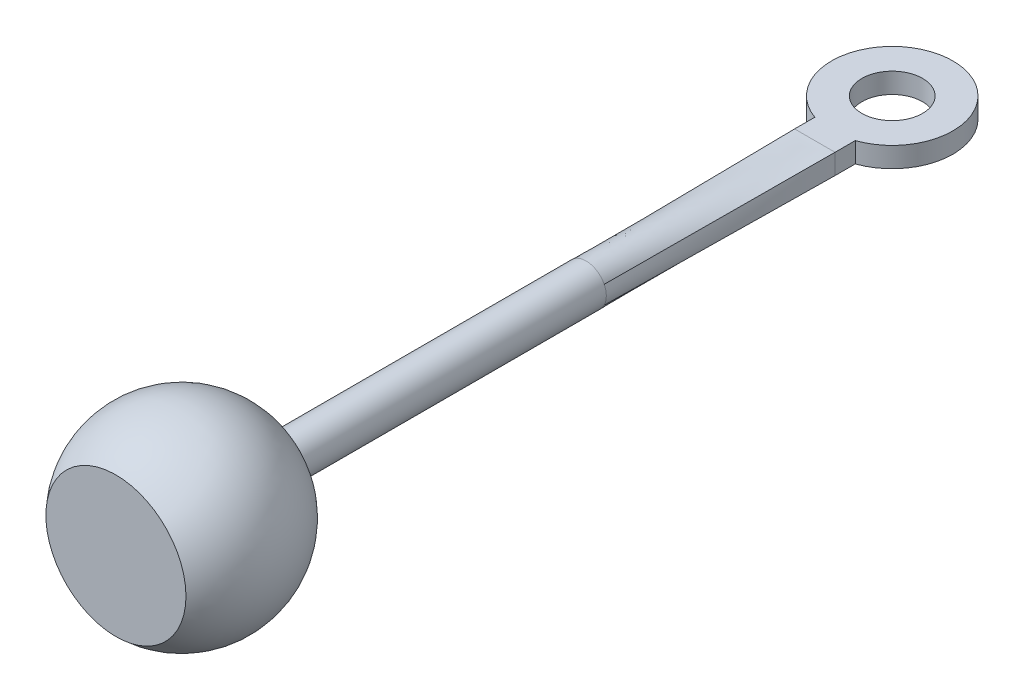
from build123d import *
from build123d.topology import SkipClean

# Parameters (mm, degrees)
SKETCH1_R               = 2
BOSS_EXTRUDE1_DEPTH     = 40
BOSS_EXTRUDE2_START     = 50
BOSS_EXTRUDE2_DEPTH     = 50
SKETCH6_R               = 6.287980689
SKETCH6_R_2             = 2
BOSS_EXTRUDE4_DEPTH     = 2
SKETCH7_R               = 6
BOSS_EXTRUDE5_DEPTH     = 2
CUT_EXTRUDE4_DEPTH      = 65.01163724
CUT_EXTRUDE4_DEPTH_BACK = 65.01163724
SKETCH13_R              = 6
CUT_EXTRUDE5_DEPTH      = 52.290837388
SKETCH14_R              = 2
CUT_EXTRUDE6_DEPTH      = 52.290837388
CUT_EXTRUDE7_DEPTH      = 52.290837388
CUT_EXTRUDE7_DEPTH_BACK = 52.290837388
CUT_EXTRUDE8_START      = -9.5
CUT_EXTRUDE8_DEPTH      = 19
SKETCH27_W              = 4
SKETCH27_H              = 2
BOSS_EXTRUDE6_DEPTH     = 2
SKETCH28_R              = 6
SKETCH28_R_2            = 3
BOSS_EXTRUDE7_DEPTH     = 2


with BuildPart() as part:
    # Sketch1 → Boss-Extrude1 (new body)
    with BuildSketch(Plane.XY):
        Circle(SKETCH1_R)
    extrude(amount=BOSS_EXTRUDE1_DEPTH)

    # Sketch2 → Revolve1 (revolve)
    with BuildSketch(Plane(origin=(0, 0, 0), x_dir=(1, 0, 0), z_dir=(0, 1, 0))):
        with BuildLine():
            Line((-9.5, -40), (9.5, -40))
            ThreePointArc((9.5, -40), (0, -30.5), (-9.5, -40))
        make_face()
    revolve(axis=Axis((-9.5, 0, 40), (1, 0, 0)))

    # Sketch3 → Boss-Extrude2 (add)
    with SkipClean():  # the faces are left unmerged after this step: merging them gives an invalid solid
        with BuildSketch(Plane(origin=(0, 0, 0), x_dir=(-1, 0, 0), z_dir=(0, 0, -1)).offset(BOSS_EXTRUDE2_START)):
            with BuildLine():
                Line((1, -1.732050808), (1, 1.732050808))
                ThreePointArc((1, 1.732050808), (0, 2), (-1, 1.732050808))
                Line((-1, 1.732050808), (-1, -1.732050808))
                ThreePointArc((-1, -1.732050808), (0, -2), (1, -1.732050808))
            make_face()
        extrude(amount=-BOSS_EXTRUDE2_DEPTH)

    # Sketch6 → Boss-Extrude4 (add)
    with SkipClean():  # the faces are left unmerged after this step: merging them gives an invalid solid
        with BuildSketch(Plane.ZY.offset(1)):
            with Locations((-55.961434487, 0)):
                Circle(SKETCH6_R)
            with Locations((-55.961434487, 0)):
                Circle(SKETCH6_R_2, mode=Mode.SUBTRACT)
        extrude(amount=-BOSS_EXTRUDE4_DEPTH)

    # Sketch7 → Boss-Extrude5 (add)
    with SkipClean():  # the faces are left unmerged after this step: merging them gives an invalid solid
        with BuildSketch(Plane(origin=(0, 0, 0), x_dir=(1, 0, 0), z_dir=(0, 1, 0))):
            with Locations((0, 30.624189127)):
                Circle(SKETCH7_R)
        extrude(amount=-BOSS_EXTRUDE5_DEPTH)

    # Sketch12 → Cut-Extrude4 (cut, two sides: drawn at the far end of the back side and taken through both)
    with SkipClean():  # the faces are left unmerged after this step: merging them gives an invalid solid
        with BuildSketch(Plane.XZ.offset(2).offset(-CUT_EXTRUDE4_DEPTH_BACK)):
            with BuildLine():
                ThreePointArc((0, -36.624189127), (-4.242640687, -34.866829814), (-6, -30.624189127))
                Line((-6, -30.624189127), (-11.247801092, -63.947701612))
                Line((-11.247801092, -63.947701612), (13.319481656, -63.947701612))
                Line((13.319481656, -63.947701612), (6, -30.624189127))
                ThreePointArc((6, -30.624189127), (4.242640687, -34.866829814), (0, -36.624189127))
            make_face()
        extrude(amount=CUT_EXTRUDE4_DEPTH + CUT_EXTRUDE4_DEPTH_BACK, mode=Mode.SUBTRACT)

    # Sketch13 → Cut-Extrude5 (cut, through all)
    with SkipClean():  # the faces are left unmerged after this step: merging them gives an invalid solid
        with BuildSketch(Plane(origin=(0, 0, 0), x_dir=(1, 0, 0), z_dir=(0, 1, 0))):
            with Locations((0, 30.624189127)):
                Circle(SKETCH13_R)
        extrude(amount=CUT_EXTRUDE5_DEPTH, mode=Mode.SUBTRACT)

    # Sketch14 → Cut-Extrude6 (cut, through all)
    with SkipClean():  # the faces are left unmerged after this step: merging them gives an invalid solid
        with BuildSketch(Plane(origin=(0, 0, 0), x_dir=(1, 0, 0), z_dir=(0, 1, 0))):
            with Locations(Location((0, 30.624189127, 0), (0, 0, 270))):
                Circle(SKETCH14_R)
        extrude(amount=-CUT_EXTRUDE6_DEPTH, mode=Mode.SUBTRACT)

    # Sketch17 → Cut-Extrude7 (cut, two sides: drawn at the far end of the back side and taken through both)
    with BuildSketch(Plane(origin=(0, 0, 0), x_dir=(1, 0, 0), z_dir=(0, 1, 0)).offset(-CUT_EXTRUDE7_DEPTH_BACK)):
        Polygon((-3.165261595, 0), (5.14515748, 0), (12.375060686, 39.939772325), (-18.008437574, 39.939772325), align=None)
    extrude(amount=CUT_EXTRUDE7_DEPTH + CUT_EXTRUDE7_DEPTH_BACK, mode=Mode.SUBTRACT)

    # Loft1: read off the stored shape, not the designer's step
    # Loft1: loft between two sections, ruled curve by curve
    loft1_from = [
        Edge.make_bspline([(2, -1, -22.62), (2, -0.666666667, -22.62), (2, -0.333333333, -22.62), (2, 0.333333333, -22.62), (2, 0.666666667, -22.62), (2, 1, -22.62)], [0, 0, 0, 0, 0.5, 0.5, 1, 1, 1, 1], 3),
        Edge.make_bspline([(2, 1, -22.62), (1.833333333, 1, -22.62), (1.666666667, 1, -22.62), (1.333333333, 1, -22.62), (1.166666667, 1, -22.62), (0.833333333, 1, -22.62), (0.666666667, 1, -22.62), (0.333333333, 1, -22.62), (0.166666667, 1, -22.62), (-0.166666667, 1, -22.62), (-0.333333333, 1, -22.62), (-0.666666667, 1, -22.62), (-0.833333333, 1, -22.62), (-1.166666667, 1, -22.62), (-1.333333333, 1, -22.62), (-1.666666667, 1, -22.62), (-1.833333333, 1, -22.62), (-2, 1, -22.62)], [0, 0, 0, 0, 0.125, 0.125, 0.25, 0.25, 0.375, 0.375, 0.5, 0.5, 0.625, 0.625, 0.75, 0.75, 0.875, 0.875, 1, 1, 1, 1], 3),
        Edge.make_bspline([(-2, -1, -22.62), (-1.833333333, -1, -22.62), (-1.666666667, -1, -22.62), (-1.333333333, -1, -22.62), (-1.166666667, -1, -22.62), (-0.833333333, -1, -22.62), (-0.666666667, -1, -22.62), (-0.333333333, -1, -22.62), (-0.166666667, -1, -22.62), (0.166666667, -1, -22.62), (0.333333333, -1, -22.62), (0.666666667, -1, -22.62), (0.833333333, -1, -22.62), (1.166666667, -1, -22.62), (1.333333333, -1, -22.62), (1.666666667, -1, -22.62), (1.833333333, -1, -22.62), (2, -1, -22.62)], [0, 0, 0, 0, 0.125, 0.125, 0.25, 0.25, 0.375, 0.375, 0.5, 0.5, 0.625, 0.625, 0.75, 0.75, 0.875, 0.875, 1, 1, 1, 1], 3),
        Edge.make_bspline([(-2, 1, -22.62), (-2, 0.666666667, -22.62), (-2, 0.333333333, -22.62), (-2, -0.333333333, -22.62), (-2, -0.666666667, -22.62), (-2, -1, -22.62)], [0, 0, 0, 0, 0.5, 0.5, 1, 1, 1, 1], 3),
    ]
    loft1_to = [
        Edge.make_bspline([(1.788854382, -0.894427191, 0), (1.922187715, -0.627760524, 0), (2, -0.314757303, 0), (2, 0.314757303, 0), (1.922187715, 0.627760524, 0), (1.788854382, 0.894427191, 0)], [0, 0, 0, 0, 0.5, 0.5, 1, 1, 1, 1], 3),
        Edge.make_bspline([(1.788854382, 0.894427191, 0), (1.722187715, 1.027760524, 0), (1.635785936, 1.163168367, 0), (1.416595823, 1.421974878, 0), (1.283592091, 1.545236413, 0), (0.973053395, 1.757421782, 0), (0.795448844, 1.846008062, 0), (0.411798664, 1.96746194, 0), (0.20601133, 2, 0), (-0.20601133, 2, 0), (-0.411798664, 1.96746194, 0), (-0.795448844, 1.846008062, 0), (-0.973053395, 1.757421782, 0), (-1.283592091, 1.545236413, 0), (-1.416595823, 1.421974878, 0), (-1.635785936, 1.163168367, 0), (-1.722187715, 1.027760524, 0), (-1.788854382, 0.894427191, 0)], [0, 0, 0, 0, 0.125, 0.125, 0.25, 0.25, 0.375, 0.375, 0.5, 0.5, 0.625, 0.625, 0.75, 0.75, 0.875, 0.875, 1, 1, 1, 1], 3),
        Edge.make_bspline([(-1.788854382, -0.894427191, 0), (-1.722187715, -1.027760524, 0), (-1.635785936, -1.163168367, 0), (-1.416595823, -1.421974878, 0), (-1.283592091, -1.545236413, 0), (-0.973053395, -1.757421782, 0), (-0.795448844, -1.846008062, 0), (-0.411798664, -1.96746194, 0), (-0.20601133, -2, 0), (0.20601133, -2, 0), (0.411798664, -1.96746194, 0), (0.795448844, -1.846008062, 0), (0.973053395, -1.757421782, 0), (1.283592091, -1.545236413, 0), (1.416595823, -1.421974878, 0), (1.635785936, -1.163168367, 0), (1.722187715, -1.027760524, 0), (1.788854382, -0.894427191, 0)], [0, 0, 0, 0, 0.125, 0.125, 0.25, 0.25, 0.375, 0.375, 0.5, 0.5, 0.625, 0.625, 0.75, 0.75, 0.875, 0.875, 1, 1, 1, 1], 3),
        Edge.make_bspline([(-1.788854382, 0.894427191, 0), (-1.922187715, 0.627760524, 0), (-2, 0.314757303, 0), (-2, -0.314757303, 0), (-1.922187715, -0.627760524, 0), (-1.788854382, -0.894427191, 0)], [0, 0, 0, 0, 0.5, 0.5, 1, 1, 1, 1], 3),
    ]
    loft1 = Solid(Shell([*[Face.make_surface_from_curves(loft1_from[k], loft1_to[k]) for k in range(4)], Face(Wire(loft1_from)), Face(Wire(loft1_to))]))
    add(loft1)

    # Cut-Extrude8: read off the stored shape, not the designer's step
    # Cut-Extrude8 outline → Cut-Extrude8 (cut)
    with BuildSketch(Plane(origin=(0, 0, 0), x_dir=(1, 0, 0), z_dir=(0, 1, 0)).offset(CUT_EXTRUDE8_START)):
        Polygon((11.636871943, -46.5), (0, -46.5), (-8.237645066, -46.5), (-8.237645066, -52.129858531), (11.636871943, -52.129858531), align=None)
    extrude(amount=CUT_EXTRUDE8_DEPTH, mode=Mode.SUBTRACT)

    # Sketch27 → Boss-Extrude6 (add)
    with BuildSketch(Plane(origin=(0, 0, -22.62), x_dir=(-1, 0, 0), z_dir=(0, 0, -1))):
        Rectangle(SKETCH27_W, SKETCH27_H)
    extrude(amount=BOSS_EXTRUDE6_DEPTH)

    # Sketch28 → Boss-Extrude7 (add)
    with BuildSketch(Plane.XZ.offset(1)):
        with Locations((0, -30.276854249)):
            Circle(SKETCH28_R)
        with Locations(Location((0, -30.276854249, 0), (0, 0, 270))):
            Circle(SKETCH28_R_2, mode=Mode.SUBTRACT)
    extrude(amount=-BOSS_EXTRUDE7_DEPTH)


solid = part.part
